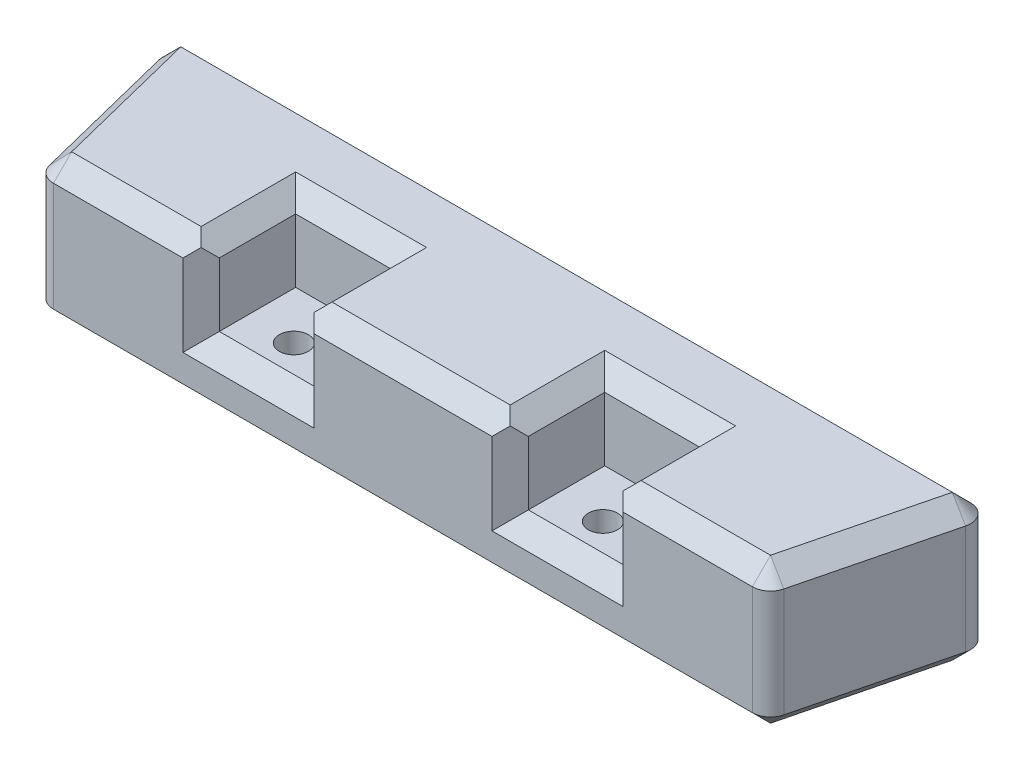
from build123d import *

# Parameters (mm, degrees)
RESSALTO_EXTRUS_O2_DEPTH = 8
ESBO_O4_W                = 5.2
ESBO_O4_H                = 5.2
CORTE_EXTRUS_O1_DEPTH    = 4.5
CHANFRO1_SIZE            = 1
CHANFRO2_SIZE            = 1
FURO_ROSCADO_DE_M21_D    = 1.6


with BuildPart() as part:
    # Esboço2 → Ressalto-extrusão2 (new body)
    with BuildSketch(Plane(origin=(0, 0, 0), x_dir=(1, 0, 0), z_dir=(0, 1, 0))):
        with BuildLine():
            Line((-0.189366094, 0.757464375), (-2.189366094, 8.757464375))
            ThreePointArc((-2.189366094, 8.757464375), (-2.007429032, 9.615412209), (-1.219223594, 10))
            Line((-1.219223594, 10), (41.219223594, 10))
            ThreePointArc((41.219223594, 10), (42.007429032, 9.615412209), (42.189366094, 8.757464375))
            Line((42.189366094, 8.757464375), (40.189366094, 0.757464375))
            ThreePointArc((40.189366094, 0.757464375), (39.834635803, 0.211794562), (39.219223594, 0))
            Line((39.219223594, 0), (0.780776406, 0))
            ThreePointArc((0.780776406, 0), (0.165364197, 0.211794562), (-0.189366094, 0.757464375))
        make_face()
    extrude(amount=RESSALTO_EXTRUS_O2_DEPTH)

    # Esboço4 → Corte-extrusão1 (cut)
    with BuildSketch(Plane(origin=(0, 8, 0), x_dir=(1, 0, 0), z_dir=(0, 1, 0))):
        with Locations((28.5, 2.6)):
            Rectangle(ESBO_O4_W, ESBO_O4_H)
        with Locations((11.5, 2.6)):
            Rectangle(ESBO_O4_W, ESBO_O4_H)
    extrude(amount=-CORTE_EXTRUS_O1_DEPTH, mode=Mode.SUBTRACT)

    # Chanfro1
    chanfro1_edges = [part.edges().sort_by_distance(p)[0] for p in [
        (-2.007429032, 8, -9.615412209),
        (-1.189366094, 8, -4.757464375),
        (0.165364197, 8, -0.211794562),
        (4.840388203, 8, 0),
        (20, 8, 0),
        (35.159611797, 8, 0),
        (39.834635803, 8, -0.211794562),
        (41.189366094, 8, -4.757464375),
        (31.1, 8, -2.6),
        (28.5, 8, -5.2),
        (25.9, 8, -2.6),
        (8.9, 8, -2.6),
        (14.1, 8, -2.6),
        (11.5, 8, -5.2),
        (42.007429032, 8, -9.615412209),
        (20, 8, -10),
    ]]
    chamfer(chanfro1_edges, length=CHANFRO1_SIZE - 0.0001)  # a hair under: the kernel refuses the full size

    # Chanfro2
    chanfro2_edges = [part.edges().sort_by_distance(p)[0] for p in [
        (-1.189366094, 0, -4.757464375),
        (-2.007429032, 0, -9.615412209),
        (20, 0, -10),
        (42.007429032, 0, -9.615412209),
        (31.1, 5.25005, 0),
        (25.9, 5.25005, 0),
        (28.5, 3.5, 0),
        (8.9, 5.25005, 0),
        (14.1, 5.25005, 0),
        (11.5, 3.5, 0),
        (41.189366094, 0, -4.757464375),
        (39.834635803, 0, -0.211794562),
        (20, 0, 0),
        (0.165364197, 0, -0.211794562),
    ]]
    chamfer(chanfro2_edges, length=CHANFRO2_SIZE - 0.0001)  # a hair under: the kernel refuses the full size

    # Furo roscado de M21 (through all)
    with Locations(Plane(origin=(28.5, 3.5, -2.5), x_dir=(0, 0, 1), z_dir=(0, 1, 0))):
        with Locations((0, 0), (0, -17)):
            Hole(FURO_ROSCADO_DE_M21_D / 2)


solid = part.part
